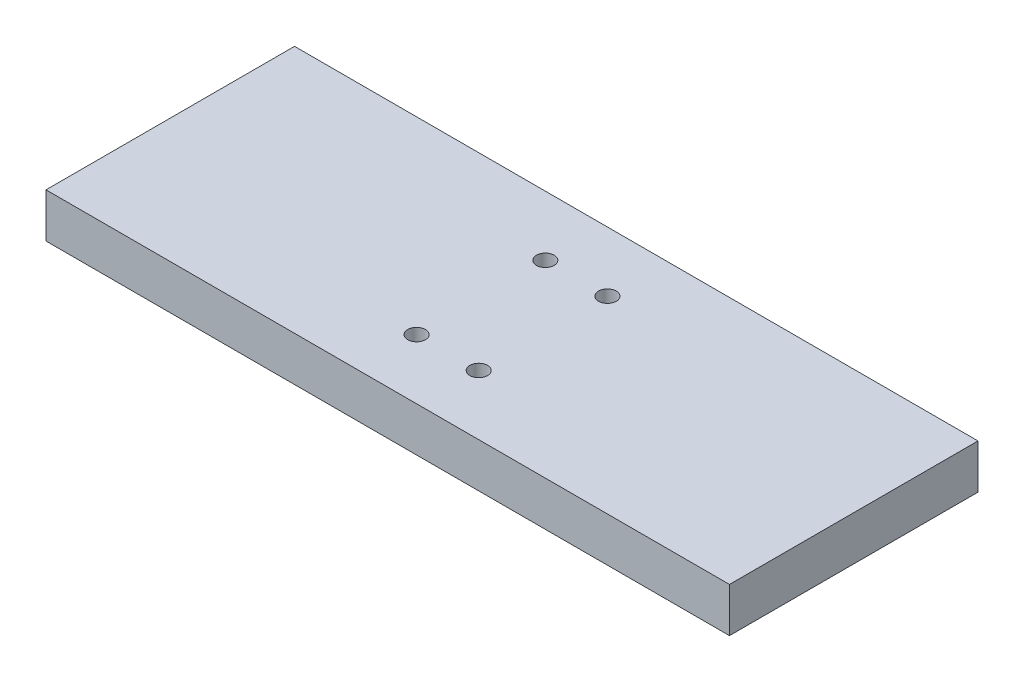
from build123d import *

# Parameters (mm, degrees)
SKETCH1_W                 = 154
SKETCH1_H                 = 56
BOSS_EXTRUDE1_DEPTH       = 10
F_4_0MM_DOWEL_HOLE3_D     = 4
F_4_0MM_DOWEL_HOLE3_DEPTH = 6
F_4_0MM_DOWEL_HOLE3_TIP   = 1.201721238


with BuildPart() as part:
    # Sketch1 → Boss-Extrude1 (new body)
    with BuildSketch(Plane(origin=(0, 0, 0), x_dir=(1, 0, 0), z_dir=(0, 1, 0))):
        Rectangle(SKETCH1_W, SKETCH1_H)
    extrude(amount=BOSS_EXTRUDE1_DEPTH)

    # Ø4.0mm Dowel Hole3
    with Locations(Plane(origin=(-7, 10, -14.5), x_dir=(0, 0, 1), z_dir=(0, 1, 0))):
        with Locations((0, 0), (29, 0), (29, 14), (0, 14)):
            Hole(F_4_0MM_DOWEL_HOLE3_D / 2, depth=F_4_0MM_DOWEL_HOLE3_DEPTH)
            with Locations((0, 0, -(F_4_0MM_DOWEL_HOLE3_DEPTH + F_4_0MM_DOWEL_HOLE3_TIP / 2))):  # 118° drill point
                Cone(0, F_4_0MM_DOWEL_HOLE3_D / 2, F_4_0MM_DOWEL_HOLE3_TIP, mode=Mode.SUBTRACT)


solid = part.part
